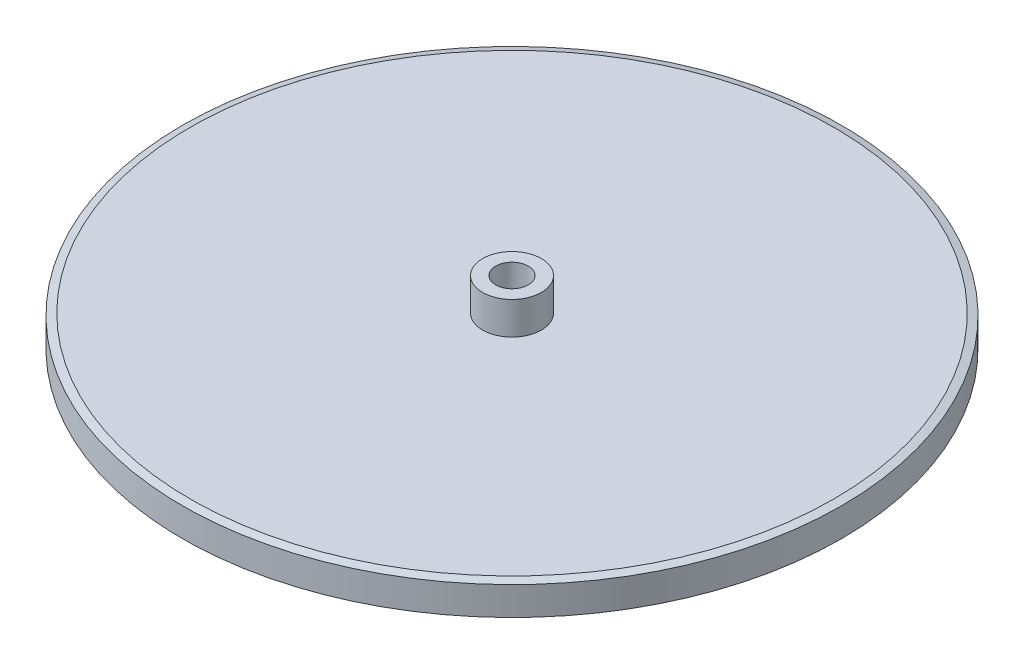
from build123d import *

# Parameters (mm, degrees)
CHAMFER_1_SIZE           = 1.175
CHAMFER_1_SIZE2          = 0.314840301
CHAMFER_2_SIZE           = 1.175
CHAMFER_2_SIZE2          = 0.314840301
CUT_EXTRUDE_3_DEPTH      = 73.114492302
CUT_EXTRUDE_3_DEPTH_BACK = 73.114492302
SKETCH_2_R               = 2.5


with BuildPart() as part:
    # Эскиз1 → Повернуть2 (revolve)
    with BuildSketch(Plane.XY):
        Polygon((0, 0), (50.5, 0), (50.5, 5), (4.5, 5), (4.5, 10), (0, 10), align=None)
    revolve(axis=Axis((0, 10, 0), (0, -1, 0)))

    # Фаска1
    chamfer_1_edges = [part.edges().sort_by_distance(p)[0] for p in [
        (-50.5, 5, 0),
    ]]
    chamfer_1_side = [part.faces().sort_by_distance(p)[0] for p in [
        (-49.071644302, 5, 0),
    ]]
    chamfer(chamfer_1_edges, length=CHAMFER_1_SIZE, length2=CHAMFER_1_SIZE2, reference=chamfer_1_side[0])

    # Фаска2
    chamfer_2_edges = [part.edges().sort_by_distance(p)[0] for p in [
        (-50.5, 0, 0),
    ]]
    chamfer_2_side = [part.faces().sort_by_distance(p)[0] for p in [
        (0, 0, 0),
    ]]
    chamfer(chamfer_2_edges, length=CHAMFER_2_SIZE, length2=CHAMFER_2_SIZE2, reference=chamfer_2_side[0])

    # Эскиз2 → Вырез-Вытянуть3 (cut, two sides: drawn at the far end of the back side and taken through both)
    with BuildSketch(Plane(origin=(0, 0, 0), x_dir=(-1, 0, 0), z_dir=(0, -1, 0)).offset(-CUT_EXTRUDE_3_DEPTH_BACK)):
        Circle(SKETCH_2_R)
    extrude(amount=CUT_EXTRUDE_3_DEPTH + CUT_EXTRUDE_3_DEPTH_BACK, mode=Mode.SUBTRACT)


solid = part.part
